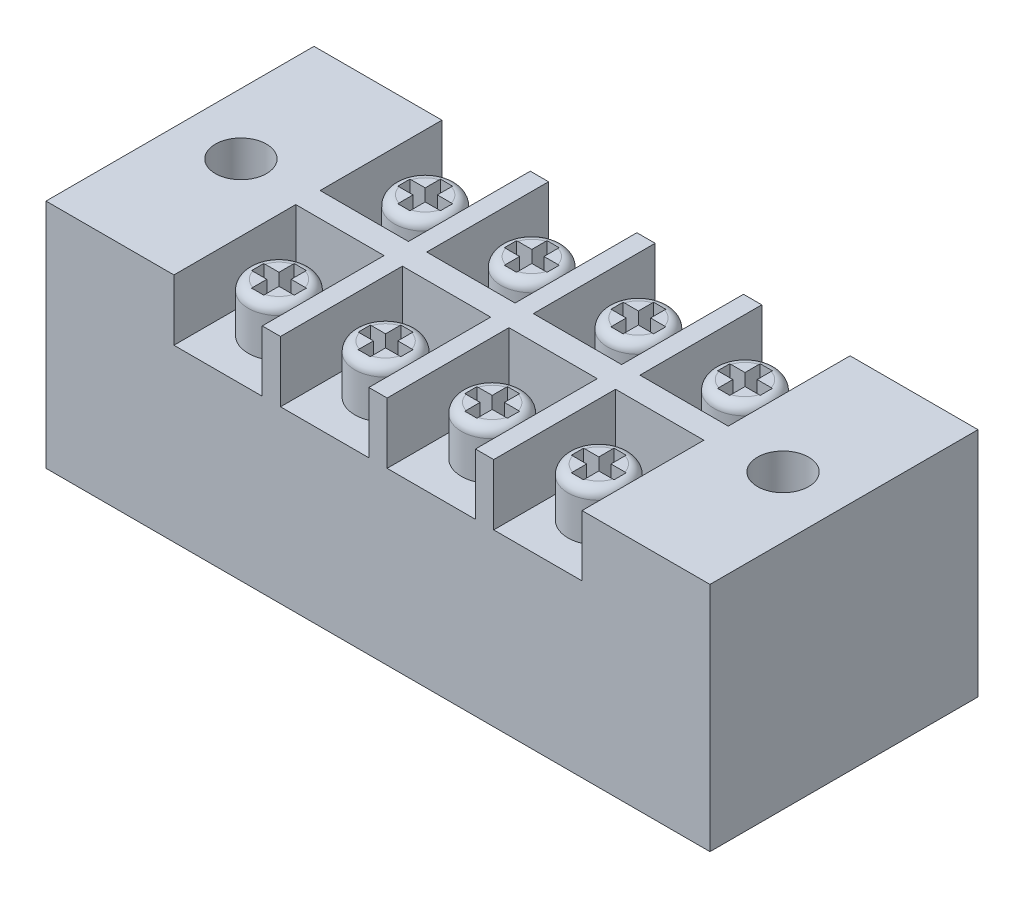
from build123d import *

# Parameters (mm, degrees)
SKETCH_1_W                     = 54.5
SKETCH_1_H                     = 22
EXTRUDE_1_DEPTH                = 19
SKETCH_2_R                     = 2.1
CUT_EXTRUDE_1_DEPTH            = 35.993749442
SKETCH_3_W                     = 7.25
SKETCH_3_H                     = 10
CUT_EXTRUDE_2_DEPTH            = 5
SKETCH_4_R                     = 2.524672765
EXTRUDE_2_DEPTH                = 4
FILLET_1_R                     = 0.8
PATTERN_LINEAR_1_COUNT         = 4
PATTERN_LINEAR_1_PITCH         = 8.75
PATTERN_LINEAR_1_COUNT_DIR2    = 2
PATTERN_LINEAR_1_PITCH_DIR2    = 12
FILLET_1_OF_PATTERN_LINEAR_1_R = 0.8


with BuildPart() as part:
    # 草图1 → 凸台-拉伸1 (new body)
    with BuildSketch(Plane(origin=(0, 0, 0), x_dir=(1, 0, 0), z_dir=(0, 1, 0))):
        Rectangle(SKETCH_1_W, SKETCH_1_H)
    extrude(amount=EXTRUDE_1_DEPTH)

    # 草图2 → 切除-拉伸1 (cut, through all)
    with BuildSketch(Plane(origin=(0, 19, 0), x_dir=(1, 0, 0), z_dir=(0, 1, 0))):
        with Locations(Location((-22.25, 0, 0), (0, 0, 270))):
            Circle(SKETCH_2_R)
        with Locations(Location((22.25, 0, 0), (0, 0, 90))):
            Circle(SKETCH_2_R)
    extrude(amount=-CUT_EXTRUDE_1_DEPTH, mode=Mode.SUBTRACT)

    # 草图3 → 切除-拉伸2 (cut)
    with BuildSketch(Plane(origin=(0, 19, 0), x_dir=(1, 0, 0), z_dir=(0, 1, 0))):
        with Locations((-13.125, 6)):
            Rectangle(SKETCH_3_W, SKETCH_3_H)
        with Locations((-4.375, 6)):
            Rectangle(SKETCH_3_W, SKETCH_3_H)
        with Locations((13.125, 6)):
            Rectangle(SKETCH_3_W, SKETCH_3_H)
        with Locations((13.125, -6)):
            Rectangle(SKETCH_3_W, SKETCH_3_H)
        with Locations((-4.375, -6)):
            Rectangle(SKETCH_3_W, SKETCH_3_H)
        with Locations((-13.125, -6)):
            Rectangle(SKETCH_3_W, SKETCH_3_H)
        with Locations((4.375, -6)):
            Rectangle(SKETCH_3_W, SKETCH_3_H)
        with Locations((4.375, 6)):
            Rectangle(SKETCH_3_W, SKETCH_3_H)
    extrude(amount=-CUT_EXTRUDE_2_DEPTH, mode=Mode.SUBTRACT)

    # 草图4 → 凸台-拉伸2 (add)
    with BuildSketch(Plane(origin=(0, 14, 0), x_dir=(1, 0, 0), z_dir=(0, 1, 0))):
        with Locations(Location((-13.125, 6, 0), (0, 0, 270))):
            Circle(SKETCH_4_R)
        Polygon((-13.625, 4.25), (-12.625, 4.25), (-12.625, 5.5), (-11.375, 5.5), (-11.375, 6.5), (-12.625, 6.5), (-12.625, 7.75), (-13.625, 7.75), (-13.625, 6.5), (-14.875, 6.5), (-14.875, 5.5), (-13.625, 5.5), align=None, mode=Mode.SUBTRACT)
    extrude_2 = extrude(amount=EXTRUDE_2_DEPTH)

    # 圆角1
    # the kernel refuses this fillet: 0.8 mm, written as the material it takes off along each edge
    with BuildSketch(Plane(origin=(-13.125, 18, -6), x_dir=(0, 0, 1), z_dir=(-1, 0, 0))) as fillet_1_piece_1:
        with BuildLine():
            CenterArc((2.524672765 - FILLET_1_R, -FILLET_1_R), FILLET_1_R, 0, 90)
            Line((2.524672765 - FILLET_1_R, 0), (2.524672765, 0))
            Line((2.524672765, 0), (2.524672765, -FILLET_1_R))
        make_face()
    revolve(axis=Axis((-13.125, 18, -6), (0, 1, 0)), mode=Mode.SUBTRACT)

    # 阵列(线性)1: Extrude 2 4 × 2
    with Locations(*[(i * PATTERN_LINEAR_1_PITCH, 0, j * PATTERN_LINEAR_1_PITCH_DIR2) for i in range(PATTERN_LINEAR_1_COUNT) for j in range(PATTERN_LINEAR_1_COUNT_DIR2) if (i, j) != (0, 0)]):
        add(extrude_2)

    # 圆角1 of 阵列(线性)1
    # the kernel refuses this fillet: 0.8 mm, written as the material it takes off along each edge
    with BuildSketch(Plane(origin=(-13.125, 18, 6), x_dir=(0, 0, 1), z_dir=(-1, 0, 0))) as fillet_1_of_pattern_linear_1_piece_1:
        with BuildLine():
            CenterArc((2.524672765 - FILLET_1_OF_PATTERN_LINEAR_1_R, -FILLET_1_OF_PATTERN_LINEAR_1_R), FILLET_1_OF_PATTERN_LINEAR_1_R, 0, 90)
            Line((2.524672765 - FILLET_1_OF_PATTERN_LINEAR_1_R, 0), (2.524672765, 0))
            Line((2.524672765, 0), (2.524672765, -FILLET_1_OF_PATTERN_LINEAR_1_R))
        make_face()
    revolve(axis=Axis((-13.125, 18, 6), (0, 1, 0)), mode=Mode.SUBTRACT)
    with BuildSketch(Plane(origin=(-4.375, 18, -6), x_dir=(0, 0, 1), z_dir=(-1, 0, 0))) as fillet_1_of_pattern_linear_1_piece_2:
        with BuildLine():
            CenterArc((2.524672765 - FILLET_1_OF_PATTERN_LINEAR_1_R, -FILLET_1_OF_PATTERN_LINEAR_1_R), FILLET_1_OF_PATTERN_LINEAR_1_R, 0, 90)
            Line((2.524672765 - FILLET_1_OF_PATTERN_LINEAR_1_R, 0), (2.524672765, 0))
            Line((2.524672765, 0), (2.524672765, -FILLET_1_OF_PATTERN_LINEAR_1_R))
        make_face()
    revolve(axis=Axis((-4.375, 18, -6), (0, 1, 0)), mode=Mode.SUBTRACT)
    with BuildSketch(Plane(origin=(-4.375, 18, 6), x_dir=(0, 0, 1), z_dir=(-1, 0, 0))) as fillet_1_of_pattern_linear_1_piece_3:
        with BuildLine():
            CenterArc((2.524672765 - FILLET_1_OF_PATTERN_LINEAR_1_R, -FILLET_1_OF_PATTERN_LINEAR_1_R), FILLET_1_OF_PATTERN_LINEAR_1_R, 0, 90)
            Line((2.524672765 - FILLET_1_OF_PATTERN_LINEAR_1_R, 0), (2.524672765, 0))
            Line((2.524672765, 0), (2.524672765, -FILLET_1_OF_PATTERN_LINEAR_1_R))
        make_face()
    revolve(axis=Axis((-4.375, 18, 6), (0, 1, 0)), mode=Mode.SUBTRACT)
    with BuildSketch(Plane(origin=(4.375, 18, -6), x_dir=(0, 0, 1), z_dir=(-1, 0, 0))) as fillet_1_of_pattern_linear_1_piece_4:
        with BuildLine():
            CenterArc((2.524672765 - FILLET_1_OF_PATTERN_LINEAR_1_R, -FILLET_1_OF_PATTERN_LINEAR_1_R), FILLET_1_OF_PATTERN_LINEAR_1_R, 0, 90)
            Line((2.524672765 - FILLET_1_OF_PATTERN_LINEAR_1_R, 0), (2.524672765, 0))
            Line((2.524672765, 0), (2.524672765, -FILLET_1_OF_PATTERN_LINEAR_1_R))
        make_face()
    revolve(axis=Axis((4.375, 18, -6), (0, 1, 0)), mode=Mode.SUBTRACT)
    with BuildSketch(Plane(origin=(4.375, 18, 6), x_dir=(0, 0, 1), z_dir=(-1, 0, 0))) as fillet_1_of_pattern_linear_1_piece_5:
        with BuildLine():
            CenterArc((2.524672765 - FILLET_1_OF_PATTERN_LINEAR_1_R, -FILLET_1_OF_PATTERN_LINEAR_1_R), FILLET_1_OF_PATTERN_LINEAR_1_R, 0, 90)
            Line((2.524672765 - FILLET_1_OF_PATTERN_LINEAR_1_R, 0), (2.524672765, 0))
            Line((2.524672765, 0), (2.524672765, -FILLET_1_OF_PATTERN_LINEAR_1_R))
        make_face()
    revolve(axis=Axis((4.375, 18, 6), (0, 1, 0)), mode=Mode.SUBTRACT)
    with BuildSketch(Plane(origin=(13.125, 18, -6), x_dir=(0, 0, 1), z_dir=(-1, 0, 0))) as fillet_1_of_pattern_linear_1_piece_6:
        with BuildLine():
            CenterArc((2.524672765 - FILLET_1_OF_PATTERN_LINEAR_1_R, -FILLET_1_OF_PATTERN_LINEAR_1_R), FILLET_1_OF_PATTERN_LINEAR_1_R, 0, 90)
            Line((2.524672765 - FILLET_1_OF_PATTERN_LINEAR_1_R, 0), (2.524672765, 0))
            Line((2.524672765, 0), (2.524672765, -FILLET_1_OF_PATTERN_LINEAR_1_R))
        make_face()
    revolve(axis=Axis((13.125, 18, -6), (0, 1, 0)), mode=Mode.SUBTRACT)
    with BuildSketch(Plane(origin=(13.125, 18, 6), x_dir=(0, 0, 1), z_dir=(-1, 0, 0))) as fillet_1_of_pattern_linear_1_piece_7:
        with BuildLine():
            CenterArc((2.524672765 - FILLET_1_OF_PATTERN_LINEAR_1_R, -FILLET_1_OF_PATTERN_LINEAR_1_R), FILLET_1_OF_PATTERN_LINEAR_1_R, 0, 90)
            Line((2.524672765 - FILLET_1_OF_PATTERN_LINEAR_1_R, 0), (2.524672765, 0))
            Line((2.524672765, 0), (2.524672765, -FILLET_1_OF_PATTERN_LINEAR_1_R))
        make_face()
    revolve(axis=Axis((13.125, 18, 6), (0, 1, 0)), mode=Mode.SUBTRACT)


solid = part.part
